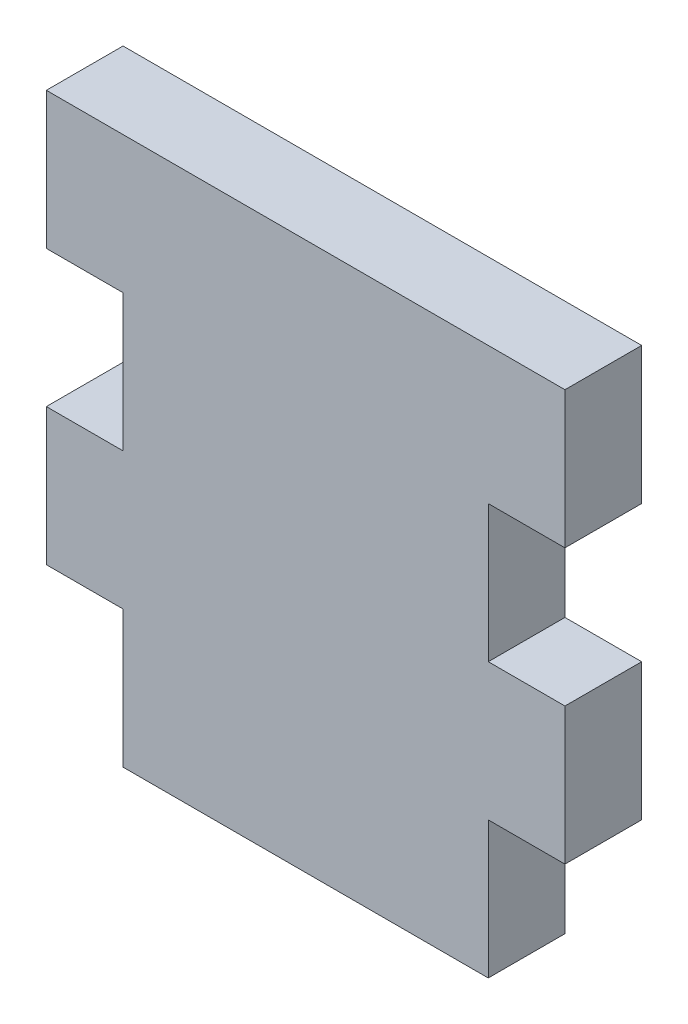
from build123d import *

# Parameters (mm, degrees)
SKETCH1_W           = 36.068
SKETCH1_H           = 38.1
BOSS_EXTRUDE1_DEPTH = 5.334
SKETCH2_W           = 5.334
SKETCH2_H           = 9.525
CUT_EXTRUDE1_DEPTH  = 92.449120695


with BuildPart() as part:
    # Sketch1 → Boss-Extrude1 (new body)
    with BuildSketch(Plane.XY):
        with Locations((-70.051249325, -4.939142782)):
            Rectangle(SKETCH1_W, SKETCH1_H)
    extrude(amount=BOSS_EXTRUDE1_DEPTH)

    # Sketch2 → Cut-Extrude1 (cut, through all)
    with BuildSketch(Plane.XY.offset(5.334)):
        with Locations((-85.418249325, -19.226642782)):
            Rectangle(SKETCH2_W, SKETCH2_H)
        with Locations((-85.418249325, -0.176642782)):
            Rectangle(SKETCH2_W, SKETCH2_H)
        with Locations((-54.684249325, -0.176642782)):
            Rectangle(SKETCH2_W, SKETCH2_H)
        with Locations((-54.684249325, -19.226642782)):
            Rectangle(SKETCH2_W, SKETCH2_H)
    extrude(amount=-CUT_EXTRUDE1_DEPTH, mode=Mode.SUBTRACT)


solid = part.part
